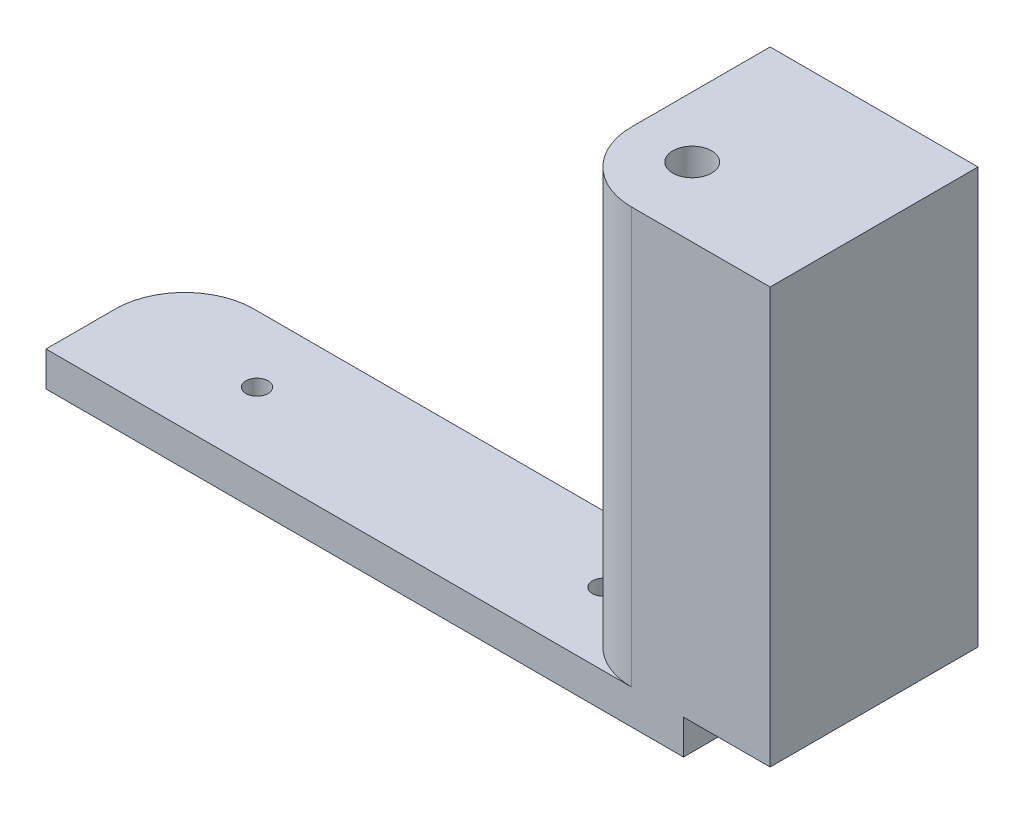
from build123d import *

# Parameters (mm, degrees)
SKETCH1_W           = 92
SKETCH1_H           = 20
BOSS_EXTRUDE1_DEPTH = 5
FILLET1_R           = 10
SKETCH2_R           = 1.6
CUT_EXTRUDE1_DEPTH  = 5
SKETCH3_W           = 30
SKETCH3_H           = 30
BOSS_EXTRUDE2_DEPTH = 60
SKETCH4_R           = 2.8
CUT_EXTRUDE2_DEPTH  = 45
FILLET5_R           = 10


with BuildPart() as part:
    # Sketch1 → Boss-Extrude1 (new body)
    with BuildSketch(Plane(origin=(0, 0, 0), x_dir=(1, 0, 0), z_dir=(0, 1, 0))):
        Rectangle(SKETCH1_W, SKETCH1_H)
    extrude(amount=BOSS_EXTRUDE1_DEPTH)

    # Fillet1
    fillet1_edges = [part.edges().sort_by_distance(p)[0] for p in [
        (46, 2.5, -10),
        (-46, 2.5, -10),
    ]]
    fillet(fillet1_edges, radius=FILLET1_R)

    # Sketch2 → Cut-Extrude1 (cut)
    with BuildSketch(Plane(origin=(0, 5, 0), x_dir=(1, 0, 0), z_dir=(0, 1, 0))):
        with Locations((-26, 0.45)):
            Circle(SKETCH2_R)
        with Locations((24, 0.45)):
            Circle(SKETCH2_R)
    extrude(amount=-CUT_EXTRUDE1_DEPTH, mode=Mode.SUBTRACT)

    # Sketch3 → Boss-Extrude2 (add)
    with BuildSketch(Plane(origin=(0, 5, 0), x_dir=(1, 0, 0), z_dir=(0, 1, 0))):
        with Locations((43.5, 5)):
            Rectangle(SKETCH3_W, SKETCH3_H)
    extrude(amount=BOSS_EXTRUDE2_DEPTH)

    # Sketch4 → Cut-Extrude2 (cut)
    with BuildSketch(Plane(origin=(0, 65, 0), x_dir=(1, 0, 0), z_dir=(0, 1, 0))):
        with Locations((37.25, 0)):
            Circle(SKETCH4_R)
    extrude(amount=-CUT_EXTRUDE2_DEPTH, mode=Mode.SUBTRACT)

    # Fillet5
    fillet5_edges = [part.edges().sort_by_distance(p)[0] for p in [
        (28.5, 35, 10),
    ]]
    fillet(fillet5_edges, radius=FILLET5_R)


solid = part.part
